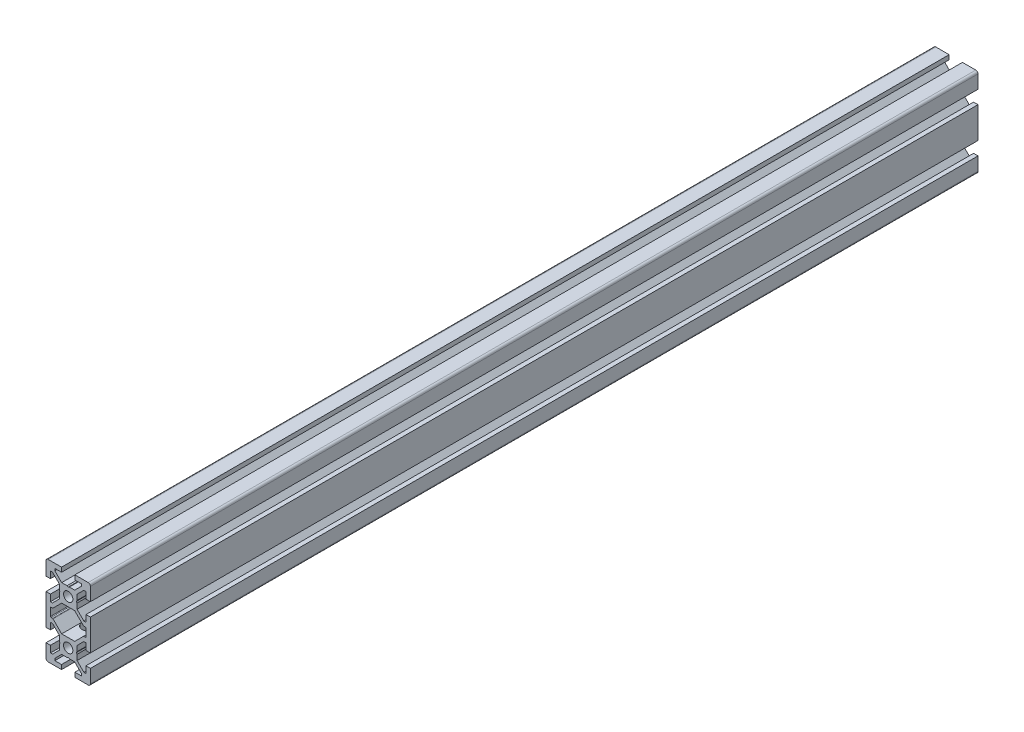
from build123d import *
from build123d.topology import SkipClean

# Parameters (mm, degrees)
SKETCH1_R           = 2.1
BOSS_EXTRUDE1_DEPTH = 350
SKETCH3_R           = 2.75
CUT_EXTRUDE1_DEPTH  = 10
SKETCH4_R           = 2.1
BOSS_EXTRUDE2_DEPTH = 50


with BuildPart() as part:
    # Sketch1 → Boss-Extrude1 (new body)
    with BuildSketch(Plane.XY):
        with BuildLine():
            Line((-8, 4), (-8, 7))
            Line((-8, 7), (-10, 7))
            Line((-10, 7), (-10, -7))
            Line((-10, -7), (-8, -7))
            Line((-8, -7), (-8, -4))
            Line((-8, -4), (-7.060660172, -4))
            Line((-7.060660172, -4), (-4, -7.060660172))
            Line((-4, -7.060660172), (-4, -9.480384758))
            Line((-4, -9.480384758), (-3.7, -10))
            Line((-3.7, -10), (-4, -10.519615242))
            Line((-4, -10.519615242), (-4, -12.939339828))
            Line((-4, -12.939339828), (-7.060660172, -16))
            Line((-7.060660172, -16), (-8, -16))
            Line((-8, -16), (-8, -13))
            Line((-8, -13), (-10, -13))
            Line((-10, -13), (-10, -19))
            ThreePointArc((-10, -19), (-9.707106781, -19.707106781), (-9, -20))
            Line((-9, -20), (-3, -20))
            Line((-3, -20), (-3, -18))
            Line((-3, -18), (-6, -18))
            Line((-6, -18), (-6, -17.060660172))
            Line((-6, -17.060660172), (-2.939339828, -14))
            Line((-2.939339828, -14), (-0.519615242, -14))
            Line((-0.519615242, -14), (0, -13.7))
            Line((0, -13.7), (0.519615242, -14))
            Line((0.519615242, -14), (2.939339828, -14))
            Line((2.939339828, -14), (6, -17.060660172))
            Line((6, -17.060660172), (6, -18))
            Line((6, -18), (3, -18))
            Line((3, -18), (3, -20))
            Line((3, -20), (9, -20))
            ThreePointArc((9, -20), (9.707106781, -19.707106781), (10, -19))
            Line((10, -19), (10, -13))
            Line((10, -13), (8, -13))
            Line((8, -13), (8, -16))
            Line((8, -16), (7.060660172, -16))
            Line((7.060660172, -16), (4, -12.939339828))
            Line((4, -12.939339828), (4, -10.519615242))
            Line((4, -10.519615242), (3.7, -10))
            Line((3.7, -10), (4, -9.480384758))
            Line((4, -9.480384758), (4, -7.060660172))
            Line((4, -7.060660172), (7.060660172, -4))
            Line((7.060660172, -4), (8, -4))
            Line((8, -4), (8, -7))
            Line((8, -7), (10, -7))
            Line((10, -7), (10, 7))
            Line((10, 7), (8, 7))
            Line((8, 7), (8, 4))
            Line((8, 4), (7.060660172, 4))
            Line((7.060660172, 4), (4, 7.060660172))
            Line((4, 7.060660172), (4, 9.480384758))
            Line((4, 9.480384758), (3.7, 10))
            Line((3.7, 10), (4, 10.519615242))
            Line((4, 10.519615242), (4, 12.939339828))
            Line((4, 12.939339828), (7.060660172, 16))
            Line((7.060660172, 16), (8, 16))
            Line((8, 16), (8, 13))
            Line((8, 13), (10, 13))
            Line((10, 13), (10, 19))
            ThreePointArc((10, 19), (9.707106781, 19.707106781), (9, 20))
            Line((9, 20), (3, 20))
            Line((3, 20), (3, 18))
            Line((3, 18), (6, 18))
            Line((6, 18), (6, 17.060660172))
            Line((6, 17.060660172), (2.939339828, 14))
            Line((2.939339828, 14), (0.519615242, 14))
            Line((0.519615242, 14), (0, 13.7))
            Line((0, 13.7), (-0.519615242, 14))
            Line((-0.519615242, 14), (-2.939339828, 14))
            Line((-2.939339828, 14), (-6, 17.060660172))
            Line((-6, 17.060660172), (-6, 18))
            Line((-6, 18), (-3, 18))
            Line((-3, 18), (-3, 20))
            Line((-3, 20), (-9, 20))
            ThreePointArc((-9, 20), (-9.707106781, 19.707106781), (-10, 19))
            Line((-10, 19), (-10, 13))
            Line((-10, 13), (-8, 13))
            Line((-8, 13), (-8, 16))
            Line((-8, 16), (-7.060660172, 16))
            Line((-7.060660172, 16), (-4, 12.939339828))
            Line((-4, 12.939339828), (-4, 10.519615242))
            Line((-4, 10.519615242), (-3.7, 10))
            Line((-3.7, 10), (-4, 9.480384758))
            Line((-4, 9.480384758), (-4, 7.060660172))
            Line((-4, 7.060660172), (-7.060660172, 4))
            Line((-7.060660172, 4), (-8, 4))
        make_face()
        with Locations((0, 10)):
            Circle(SKETCH1_R, mode=Mode.SUBTRACT)
        with Locations((0, -10)):
            Circle(SKETCH1_R, mode=Mode.SUBTRACT)
        with BuildLine():
            Line((-8, -1.7), (-8, 1.7))
            ThreePointArc((-8, 1.7), (-7.912132034, 1.912132034), (-7.7, 2))
            Line((-7.7, 2), (-7.063603897, 2))
            ThreePointArc((-7.063603897, 2), (-6.948798867, 2.02283614), (-6.851471863, 2.087867966))
            Line((-6.851471863, 2.087867966), (-2.939339828, 6))
            Line((-2.939339828, 6), (2.939339828, 6))
            Line((2.939339828, 6), (6.851471863, 2.087867966))
            ThreePointArc((6.851471863, 2.087867966), (6.948798867, 2.02283614), (7.063603897, 2))
            Line((7.063603897, 2), (7.7, 2))
            ThreePointArc((7.7, 2), (7.912132034, 1.912132034), (8, 1.7))
            Line((8, 1.7), (8, -1.7))
            ThreePointArc((8, -1.7), (7.912132034, -1.912132034), (7.7, -2))
            Line((7.7, -2), (7.063603897, -2))
            ThreePointArc((7.063603897, -2), (6.948798867, -2.02283614), (6.851471863, -2.087867966))
            Line((6.851471863, -2.087867966), (2.939339828, -6))
            Line((2.939339828, -6), (-2.939339828, -6))
            Line((-2.939339828, -6), (-6.851471863, -2.087867966))
            ThreePointArc((-6.851471863, -2.087867966), (-6.948798867, -2.02283614), (-7.063603897, -2))
            Line((-7.063603897, -2), (-7.7, -2))
            ThreePointArc((-7.7, -2), (-7.912132034, -1.912132034), (-8, -1.7))
        make_face(mode=Mode.SUBTRACT)
    extrude(amount=-BOSS_EXTRUDE1_DEPTH)

    # Sketch3 → Cut-Extrude1 (cut)
    with BuildSketch(Plane.XZ.offset(14)):
        with Locations((0, -9)):
            Circle(SKETCH3_R)
    extrude(amount=-CUT_EXTRUDE1_DEPTH, mode=Mode.SUBTRACT)

    # Sketch4 → Boss-Extrude2 (add)
    with SkipClean():  # the faces are left unmerged after this step: merging them gives an invalid solid
        with BuildSketch(Plane(origin=(0, 0, -350), x_dir=(-1, 0, 0), z_dir=(0, 0, -1))):
            with BuildLine():
                Line((8, 4), (7.060660172, 4))
                Line((7.060660172, 4), (4, 7.060660172))
                Line((4, 7.060660172), (4, 9.480384758))
                Line((4, 9.480384758), (3.7, 10))
                Line((3.7, 10), (4, 10.519615242))
                Line((4, 10.519615242), (4, 12.939339828))
                Line((4, 12.939339828), (7.060660172, 16))
                Line((7.060660172, 16), (8, 16))
                Line((8, 16), (8, 13))
                Line((8, 13), (10, 13))
                Line((10, 13), (10, 19))
                ThreePointArc((10, 19), (9.707106781, 19.707106781), (9, 20))
                Line((9, 20), (3, 20))
                Line((3, 20), (3, 18))
                Line((3, 18), (6, 18))
                Line((6, 18), (6, 17.060660172))
                Line((6, 17.060660172), (2.939339828, 14))
                Line((2.939339828, 14), (0.519615242, 14))
                Line((0.519615242, 14), (0, 13.7))
                Line((0, 13.7), (-0.519615242, 14))
                Line((-0.519615242, 14), (-2.939339828, 14))
                Line((-2.939339828, 14), (-6, 17.060660172))
                Line((-6, 17.060660172), (-6, 18))
                Line((-6, 18), (-3, 18))
                Line((-3, 18), (-3, 20))
                Line((-3, 20), (-9, 20))
                ThreePointArc((-9, 20), (-9.707106781, 19.707106781), (-10, 19))
                Line((-10, 19), (-10, 13))
                Line((-10, 13), (-8, 13))
                Line((-8, 13), (-8, 16))
                Line((-8, 16), (-7.060660172, 16))
                Line((-7.060660172, 16), (-4, 12.939339828))
                Line((-4, 12.939339828), (-4, 10.519615242))
                Line((-4, 10.519615242), (-3.7, 10))
                Line((-3.7, 10), (-4, 9.480384758))
                Line((-4, 9.480384758), (-4, 7.060660172))
                Line((-4, 7.060660172), (-7.060660172, 4))
                Line((-7.060660172, 4), (-8, 4))
                Line((-8, 4), (-8, 7))
                Line((-8, 7), (-10, 7))
                Line((-10, 7), (-10, -7))
                Line((-10, -7), (-8, -7))
                Line((-8, -7), (-8, -4))
                Line((-8, -4), (-7.060660172, -4))
                Line((-7.060660172, -4), (-4, -7.060660172))
                Line((-4, -7.060660172), (-4, -9.480384758))
                Line((-4, -9.480384758), (-3.7, -10))
                Line((-3.7, -10), (-4, -10.519615242))
                Line((-4, -10.519615242), (-4, -12.939339828))
                Line((-4, -12.939339828), (-7.060660172, -16))
                Line((-7.060660172, -16), (-8, -16))
                Line((-8, -16), (-8, -13))
                Line((-8, -13), (-10, -13))
                Line((-10, -13), (-10, -19))
                ThreePointArc((-10, -19), (-9.707106781, -19.707106781), (-9, -20))
                Line((-9, -20), (-3, -20))
                Line((-3, -20), (-3, -18))
                Line((-3, -18), (-6, -18))
                Line((-6, -18), (-6, -17.060660172))
                Line((-6, -17.060660172), (-2.939339828, -14))
                Line((-2.939339828, -14), (-0.519615242, -14))
                Line((-0.519615242, -14), (0, -13.7))
                Line((0, -13.7), (0.519615242, -14))
                Line((0.519615242, -14), (2.939339828, -14))
                Line((2.939339828, -14), (6, -17.060660172))
                Line((6, -17.060660172), (6, -18))
                Line((6, -18), (3, -18))
                Line((3, -18), (3, -20))
                Line((3, -20), (9, -20))
                ThreePointArc((9, -20), (9.707106781, -19.707106781), (10, -19))
                Line((10, -19), (10, -13))
                Line((10, -13), (8, -13))
                Line((8, -13), (8, -16))
                Line((8, -16), (7.060660172, -16))
                Line((7.060660172, -16), (4, -12.939339828))
                Line((4, -12.939339828), (4, -10.519615242))
                Line((4, -10.519615242), (3.7, -10))
                Line((3.7, -10), (4, -9.480384758))
                Line((4, -9.480384758), (4, -7.060660172))
                Line((4, -7.060660172), (7.060660172, -4))
                Line((7.060660172, -4), (8, -4))
                Line((8, -4), (8, -7))
                Line((8, -7), (10, -7))
                Line((10, -7), (10, 7))
                Line((10, 7), (8, 7))
                Line((8, 7), (8, 4))
            make_face()
            with Locations((0, 10)):
                Circle(SKETCH4_R, mode=Mode.SUBTRACT)
            with Locations((0, -10)):
                Circle(SKETCH4_R, mode=Mode.SUBTRACT)
            with BuildLine():
                Line((-2.939339828, 6), (2.939339828, 6))
                Line((2.939339828, 6), (6.851471863, 2.087867966))
                ThreePointArc((6.851471863, 2.087867966), (6.948798867, 2.02283614), (7.063603897, 2))
                Line((7.063603897, 2), (7.7, 2))
                ThreePointArc((7.7, 2), (7.912132034, 1.912132034), (8, 1.7))
                Line((8, 1.7), (8, -1.7))
                ThreePointArc((8, -1.7), (7.912132034, -1.912132034), (7.7, -2))
                Line((7.7, -2), (7.063603897, -2))
                ThreePointArc((7.063603897, -2), (6.948798867, -2.02283614), (6.851471863, -2.087867966))
                Line((6.851471863, -2.087867966), (2.939339828, -6))
                Line((2.939339828, -6), (-2.939339828, -6))
                Line((-2.939339828, -6), (-6.851471863, -2.087867966))
                ThreePointArc((-6.851471863, -2.087867966), (-6.948798867, -2.02283614), (-7.063603897, -2))
                Line((-7.063603897, -2), (-7.7, -2))
                ThreePointArc((-7.7, -2), (-7.912132034, -1.912132034), (-8, -1.7))
                Line((-8, -1.7), (-8, 1.7))
                ThreePointArc((-8, 1.7), (-7.912132034, 1.912132034), (-7.7, 2))
                Line((-7.7, 2), (-7.063603897, 2))
                ThreePointArc((-7.063603897, 2), (-6.948798867, 2.02283614), (-6.851471863, 2.087867966))
                Line((-6.851471863, 2.087867966), (-2.939339828, 6))
            make_face(mode=Mode.SUBTRACT)
        extrude(amount=BOSS_EXTRUDE2_DEPTH)
    add(part.part.scale(1), mode=Mode.REPLACE)  # the faces are merged on a copy


solid = part.part
